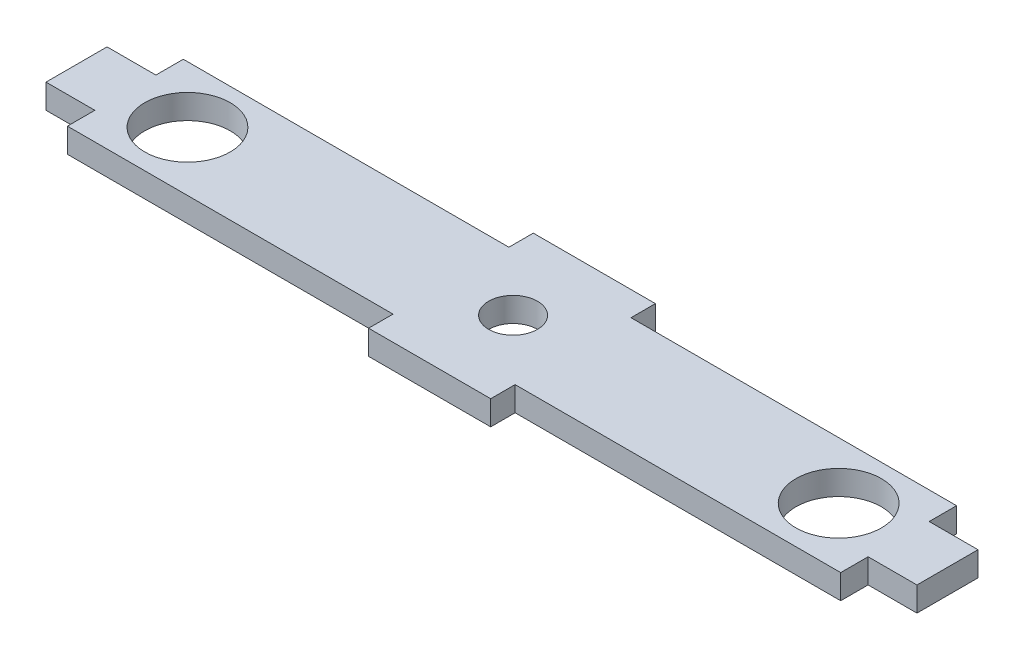
from build123d import *

# Parameters (mm, degrees)
SKETCH_1_R      = 10.5
SKETCH_1_R_2    = 6
EXTRUDE_1_DEPTH = 6


with BuildPart() as part:
    # Эскиз1 → Бобышка-Вытянуть1 (new body)
    with BuildSketch(Plane(origin=(0, 0, 0), x_dir=(1, 0, 0), z_dir=(0, 1, 0))):
        Polygon((-95, 14.235), (-15, 14.235), (-15, 20.235), (15, 20.235), (15, 14.235), (95, 14.235), (95, 7.5), (107, 7.5), (107, -7.5), (95, -7.5), (95, -14.235), (15, -14.235), (15, -20.235), (-15, -20.235), (-15, -14.235), (-95, -14.235), (-95, -7.5), (-107, -7.5), (-107, 7.5), (-95, 7.5), align=None)
        with Locations((-80, 0.265)):
            Circle(SKETCH_1_R, mode=Mode.SUBTRACT)
        with Locations((80, 0.265)):
            Circle(SKETCH_1_R, mode=Mode.SUBTRACT)
        with Locations((0, 0.265)):
            Circle(SKETCH_1_R_2, mode=Mode.SUBTRACT)
    extrude(amount=EXTRUDE_1_DEPTH)


solid = part.part
